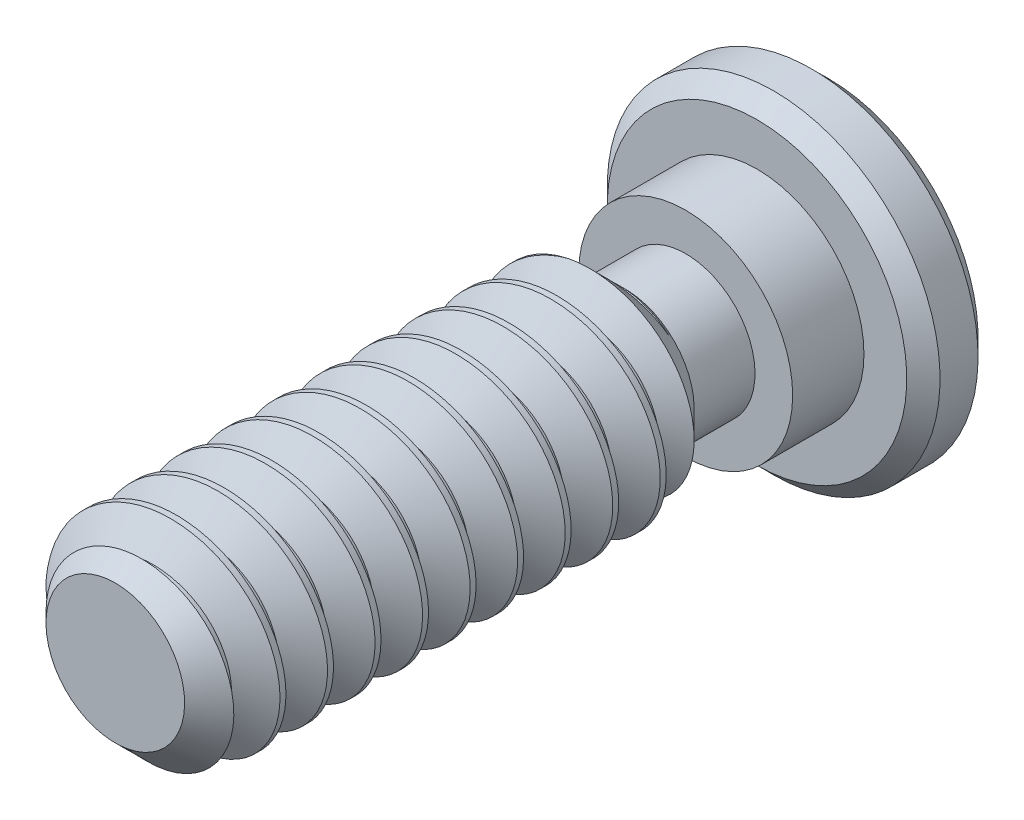
from build123d import *

# Parameters (mm, degrees)
CHAMFER2_SIZE      = 0.5953125
CUT_EXTRUDE1_DEPTH = 1.190625
CHAMFER1_SIZE      = 0.2778125
CUT_SWEEP1_PITCH   = 0.79375


with BuildPart() as part:
    # Sketch13 → Revolve1 (revolve)
    with BuildSketch(Plane(origin=(0, 0, 0), x_dir=(0, 0, -1), z_dir=(1, 0, 0)), mode=Mode.PRIVATE) as revolve1_sk:
        Polygon((1.190625, 2.778125), (0, 2.778125), (0, 1.7859375), (-1.190625, 1.7859375), (-1.190625, 1.1572875), (-2.206625, 1.1572875), (-2.8019375, 1.7526), (-10.715625, 1.7526), (-10.715625, 0), (1.190625, 0), align=None)
    revolve(revolve1_sk.sketch.rotate(Axis((0, 0, 10.715625), (0, 0, -1)), 180), axis=Axis((0, 0, 10.715625), (0, 0, -1)))

    # Chamfer2
    chamfer2_edges = [part.edges().sort_by_distance(p)[0] for p in [
        (0, 1.7526, 10.715625),
    ]]
    chamfer(chamfer2_edges, length=CHAMFER2_SIZE)

    # Sketch7 → Cut-Extrude1 (cut)
    with BuildSketch(Plane(origin=(0, 0, -1.190625), x_dir=(-1, 0, 0), z_dir=(0, 0, -1))):
        Polygon((0, 0.916543552), (-0.79375, 0.458271776), (-0.79375, -0.458271776), (0, -0.916543552), (0.79375, -0.458271776), (0.79375, 0.458271776), align=None)
    extrude(amount=-CUT_EXTRUDE1_DEPTH, mode=Mode.SUBTRACT)

    # Chamfer1
    chamfer1_edges = [part.edges().sort_by_distance(p)[0] for p in [
        (0, 2.778125, 0),
        (0, 2.778125, -1.190625),
    ]]
    chamfer(chamfer1_edges, length=CHAMFER1_SIZE)

    # Cut-Extrude2 cone 1 section (through the dimple's axis) → Cut-Extrude2 (revolve, cut)
    with BuildSketch(Plane(origin=(0, 0, -1.190625), x_dir=(0, 1, 0), z_dir=(1, 0, 0))):
        Polygon((0, 0), (0.916543552, 0), (0, 0.916543552), align=None)
    revolve(axis=Axis((0, 0, -1.190625), (0, 0, 1)), mode=Mode.SUBTRACT)

    # Cut-Sweep1: the profile of Sketch3 screwed along a right-hand helix of 11.68 turns, 6 arcs to a turn; built about Z, then put on its axis
    cut_sweep1_z = Axis((0, 0, 0), (0, 0, 1))
    cut_sweep1_corners = [(1.795562979, 0, -0.719335938), (1.795562979, 0, 0.024804687), (1.237044252, 0, -0.29765625), (1.237044252, 0, -0.396875)]
    with BuildLine(mode=Mode.PRIVATE) as cut_sweep1_profile:
        Line(cut_sweep1_corners[0], cut_sweep1_corners[1])
        Line(cut_sweep1_corners[1], cut_sweep1_corners[2])
        Line(cut_sweep1_corners[2], cut_sweep1_corners[3])
        Line(cut_sweep1_corners[3], cut_sweep1_corners[0])
    cut_sweep1_cap = Face(cut_sweep1_profile.wire())
    cut_sweep1_turn_angles = [0, 30, 60, 90, 120, 150, 180, 210, 240, 270, 300, 330, 360]
    cut_sweep1_turn_weights = [1, 0.8660254037844387, 1, 0.8660254037844387, 1, 0.8660254037844387, 1, 0.8660254037844387, 1, 0.8660254037844387, 1, 0.8660254037844387, 1]
    cut_sweep1_turn_rails = [Edge.make_bspline([Vector(p[0], p[1], 0).rotate(cut_sweep1_z, cut_sweep1_turn_angles[k]) / cut_sweep1_turn_weights[k] + Vector(0, 0, p[2] + CUT_SWEEP1_PITCH * cut_sweep1_turn_angles[k] / 360) for k in range(13)], [0, 0, 0, 1, 1, 2, 2, 3, 3, 4, 4, 5, 5, 6, 6, 6], 2, cut_sweep1_turn_weights) for p in cut_sweep1_corners]
    cut_sweep1_turn_sides = [Face.make_surface_from_curves(cut_sweep1_turn_rails[p[0]], cut_sweep1_turn_rails[p[1]]) for p in [(0, 1), (1, 2), (2, 3), (3, 0)]]
    cut_sweep1_last_angles = [3960, 3990, 4020, 4050, 4080, 4110, 4140, 4170, 4200, 4202.4, 4204.8]
    cut_sweep1_last_weights = [1, 0.8660254037844387, 1, 0.8660254037844387, 1, 0.8660254037844387, 1, 0.8660254037844387, 1, 0.9991228300988639, 1]
    cut_sweep1_last_rails = [Edge.make_bspline([Vector(p[0], p[1], 0).rotate(cut_sweep1_z, cut_sweep1_last_angles[k]) / cut_sweep1_last_weights[k] + Vector(0, 0, p[2] + CUT_SWEEP1_PITCH * cut_sweep1_last_angles[k] / 360) for k in range(11)], [0, 0, 0, 1, 1, 2, 2, 3, 3, 4, 4, 5, 5, 5], 2, cut_sweep1_last_weights) for p in cut_sweep1_corners]
    cut_sweep1_last_sides = [Face.make_surface_from_curves(cut_sweep1_last_rails[p[0]], cut_sweep1_last_rails[p[1]]) for p in [(0, 1), (1, 2), (2, 3), (3, 0)]]
    cut_sweep1 = Plane(origin=(0, 0, 10.715625), x_dir=(0, 1, 0), z_dir=(0, 0, -1)) * Solid(Shell([*[p.moved(Location((0, 0, CUT_SWEEP1_PITCH * i))) for i in range(11) for p in cut_sweep1_turn_sides], *cut_sweep1_last_sides, cut_sweep1_cap, cut_sweep1_cap.rotate(cut_sweep1_z, 4204.8).moved(Location((0, 0, CUT_SWEEP1_PITCH * 4204.8 / 360)))]))
    add(cut_sweep1, mode=Mode.SUBTRACT)


solid = part.part
